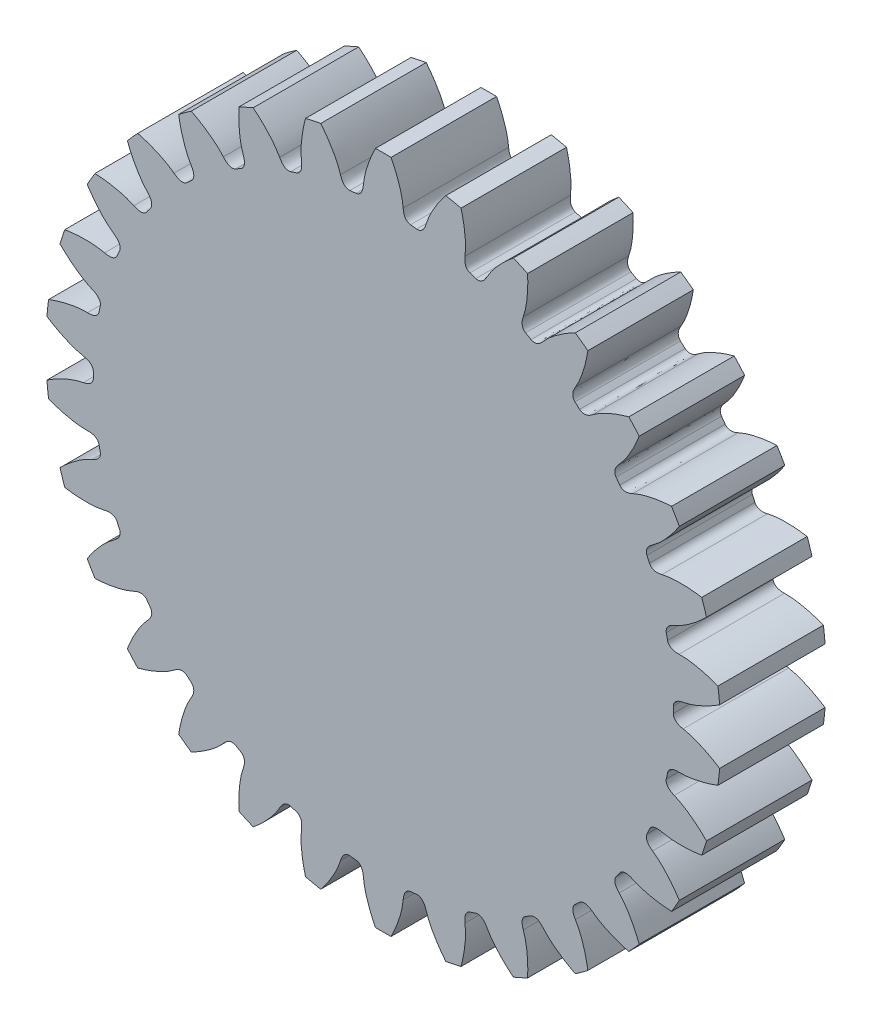
from build123d import *

# Parameters (mm, degrees)
SKETCH_1_R               = 13.75
EXTRUDE_1_DEPTH          = 5
EXTRUDE_3_DEPTH          = 5
PATTERN_CIRCULAR_1_COUNT = 30


with BuildPart() as part:
    # 스케치1 → 보스-돌출1 (new body)
    with BuildSketch(Plane.XY):
        Circle(SKETCH_1_R)
    extrude(amount=EXTRUDE_1_DEPTH)

    # 스케치2 → 보스-돌출3 (add)
    with BuildSketch(Plane(origin=(0, 0, 0), x_dir=(-1, 0, 0), z_dir=(0, 0, -1))):
        with BuildLine():
            add(Edge.make_bspline(
                [(0.943971131, 14.199183287), (0.947743847, 14.147222904), (0.957593019, 14.070934002), (0.983944479, 13.97319216), (1.01120462, 13.903616299), (1.050140312, 13.835066614), (1.131499486, 13.740023201), (1.224794796, 13.694887657), (1.29553697, 13.688830628)],
                knots=[0, 0, 0, 0, 0.231491749, 0.340328756, 0.448855795, 0.562511034, 0.688918008, 1, 1, 1, 1], degree=3))
            ThreePointArc((1.29553697, 13.688830628), (0, -13.75), (-1.29553697, 13.688830628))
            add(Edge.make_bspline(
                [(-0.943971131, 14.199183287), (-0.947743847, 14.147222904), (-0.957593019, 14.070934002), (-0.983944479, 13.97319216), (-1.01120462, 13.903616299), (-1.050140312, 13.835066614), (-1.131499486, 13.740023201), (-1.224794796, 13.694887657), (-1.29553697, 13.688830628)],
                knots=[0, 0, 0, 0, 0.231491749, 0.340328756, 0.448855795, 0.562511034, 0.688918008, 1, 1, 1, 1], degree=3))
            add(Edge.make_bspline(
                [(-0.943971131, 14.199183287), (-0.937516633, 14.28720599), (-0.917679451, 14.435861531), (-0.873734307, 14.65462173), (-0.819827545, 14.867694107), (-0.745209425, 15.111257284), (-0.60596628, 15.496422662), (-0.471833778, 15.792453992), (-0.368667248, 15.995752075)],
                knots=[0, 0, 0, 0, 0.139507309, 0.236884132, 0.352676404, 0.486884125, 0.639507298, 1, 1, 1, 1], degree=3))
            ThreePointArc((-0.368667248, 15.995752075), (0, 16), (0.368667248, 15.995752075))
            add(Edge.make_bspline(
                [(0.943971131, 14.199183287), (0.937516633, 14.28720599), (0.917679451, 14.435861531), (0.873734307, 14.65462173), (0.819827545, 14.867694107), (0.745209425, 15.111257284), (0.60596628, 15.496422662), (0.471833778, 15.792453992), (0.368667248, 15.995752075)],
                knots=[0, 0, 0, 0, 0.139507309, 0.236884132, 0.352676404, 0.486884125, 0.639507298, 1, 1, 1, 1], degree=3))
        make_face()
    extrude_3 = extrude(amount=-EXTRUDE_3_DEPTH)

    # 원형 패턴1: 보스-돌출3 ×30 about axis
    pattern_circular_1_axis = Axis((0, 0, 5), (0, 0, -1))
    for i in range(1, PATTERN_CIRCULAR_1_COUNT):
        add(extrude_3.rotate(pattern_circular_1_axis, i * 360 / PATTERN_CIRCULAR_1_COUNT))


solid = part.part
